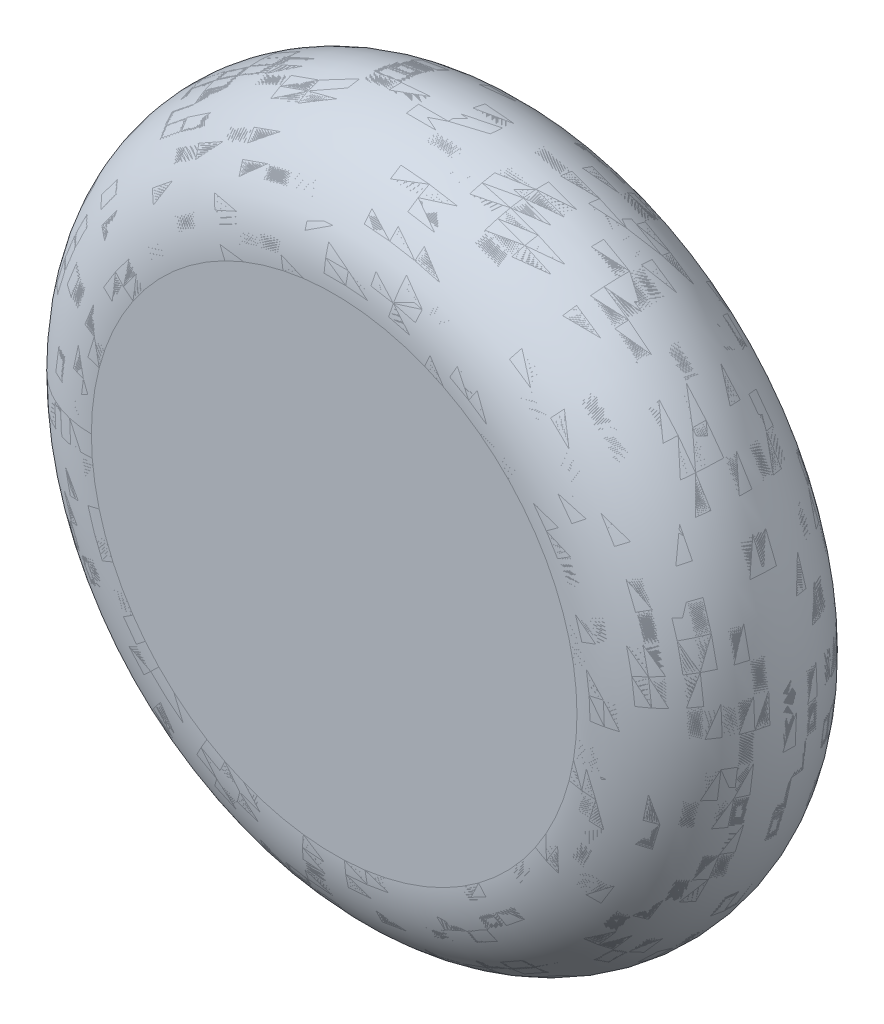
from build123d import *

# Parameters (mm, degrees)
CROQUIS1_R              = 45
SALIENTE_EXTRUIR1_DEPTH = 40


# Read off the part's stored shape, not the designer's step: Revolución1
with BuildPart() as part:
    # Croquis1 → Saliente-Extruir1 (new body)
    with BuildSketch(Plane.XY):
        Circle(CROQUIS1_R)
    extrude(amount=SALIENTE_EXTRUIR1_DEPTH)


with BuildPart() as body_2:
    # Revolución1 outline → Revolución1 (revolve)
    with BuildSketch(Plane.XZ):
        with BuildLine():
            ThreePointArc((45, 0), (65, 20), (45, 40))
            Line((45, 40), (45, 0))
        make_face()
    revolve(axis=Axis((0, 0, 0), (0, 0, 1)))


with BuildPart() as body_3:
    # Revoluci_n1 2 outline → Revoluci_n1 2 (revolve)
    with BuildSketch(Plane.XZ):
        with BuildLine():
            ThreePointArc((45, 0), (65, 20), (45, 40))
            Line((45, 40), (45, 0))
        make_face()
    revolve(axis=Axis((0, 0, 0), (0, 0, 1)))


solid = Compound([part.part, body_2.part, body_3.part])
